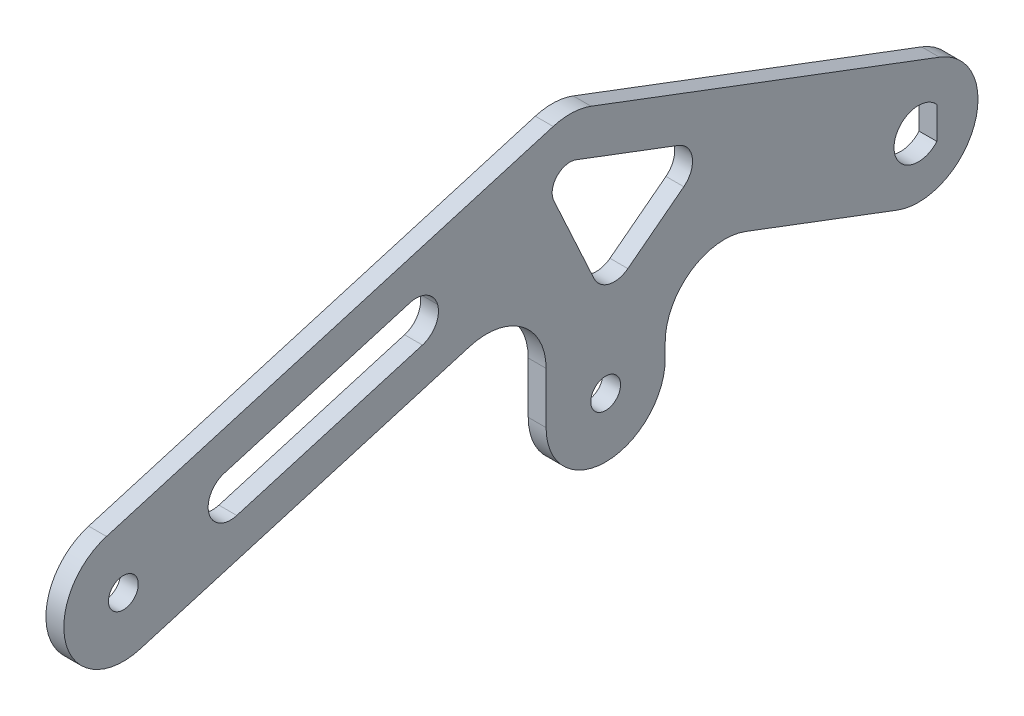
from build123d import *

# Parameters (mm, degrees)
SKETCH3_R           = 3
SKETCH3_R_2         = 2.5
BOSS_EXTRUDE2_DEPTH = 3
FILLET1_R           = 10
CUT_EXTRUDE1_DEPTH  = 10
FILLET2_R           = 3.75


with BuildPart() as part:
    # Sketch3 → Boss-Extrude2 (new body)
    with BuildSketch(Plane(origin=(0, 0, 0), x_dir=(0, 0, -1), z_dir=(1, 0, 0))):
        with BuildLine():
            Line((7.171582169, 19.591665787), (82.171582169, 41.707880218))
            ThreePointArc((82.171582169, 41.707880218), (85.373366716, 42.109241865), (88.536274395, 41.470077986))
            Line((88.536274395, 41.470077986), (147.036274395, 19.353863555))
            ThreePointArc((147.036274395, 19.353863555), (152.853863555, 6.463725605), (139.963725605, 0.646136445))
            Line((139.963725605, 0.646136445), (100.980229255, 15.384040113))
            Line((100.980229255, 15.384040113), (100.980229255, -1.493532665))
            ThreePointArc((100.980229255, -1.493532665), (90.980229255, -11.493532665), (80.980229255, -1.493532665))
            Line((80.980229255, -1.493532665), (80.980229255, 20.505135217))
            Line((80.980229255, 20.505135217), (12.828417831, 0.408334213))
            ThreePointArc((12.828417831, 0.408334213), (0.408334213, 7.171582169), (7.171582169, 19.591665787))
        make_face()
        with Locations((85, 32.116214431)):
            Circle(SKETCH3_R, mode=Mode.SUBTRACT)
        with Locations((90.980229255, -1.493532665)):
            Circle(SKETCH3_R_2, mode=Mode.SUBTRACT)
        with Locations((10, 10)):
            Circle(SKETCH3_R_2, mode=Mode.SUBTRACT)
        with BuildLine():
            Line((146.6, 12.683281573), (146.6, 7.316718427))
            ThreePointArc((146.6, 7.316718427), (139.4, 10), (146.6, 12.683281573))
        make_face(mode=Mode.SUBTRACT)
    extrude(amount=BOSS_EXTRUDE2_DEPTH)

    # Fillet1
    fillet1_edges = [part.edges().sort_by_distance(p)[0] for p in [
        (1.5, 20.505135217, -80.980229255),
        (1.5, 15.384040113, -100.980229255),
    ]]
    fillet(fillet1_edges, radius=FILLET1_R)

    # Sketch5 → Cut-Extrude1 (cut)
    with BuildSketch(Plane(origin=(0, 0, 0), x_dir=(0, 0, -1), z_dir=(1, 0, 0))):
        Polygon((23.326841994, 17.839501416), (61.693505144, 29.153172739), (63.814818517, 21.959423399), (25.448155367, 10.645752076), align=None)
        with BuildLine():
            Line((86.060882319, 34.922373497), (109.445541205, 26.081687509))
            Line((109.445541205, 26.081687509), (90.980229255, 11.910433147))
            Line((90.980229255, 11.910433147), (82.273860108, 30.863951963))
            ThreePointArc((82.273860108, 30.863951963), (82.806608326, 34.162927153), (86.060882319, 34.922373497))
        make_face()
    extrude(amount=CUT_EXTRUDE1_DEPTH, mode=Mode.SUBTRACT)

    # Fillet2
    fillet2_edges = [part.edges().sort_by_distance(p)[0] for p in [
        (1.5, 11.910433147, -90.980229255),
        (1.5, 26.081687509, -109.445541205),
        (1.5, 29.153172739, -61.693505144),
        (1.5, 21.959423399, -63.814818517),
        (1.5, 10.645752076, -25.448155367),
        (1.5, 17.839501416, -23.326841994),
    ]]
    fillet(fillet2_edges, radius=FILLET2_R - 0.0001)  # a hair under: the kernel refuses the full size


solid = part.part
